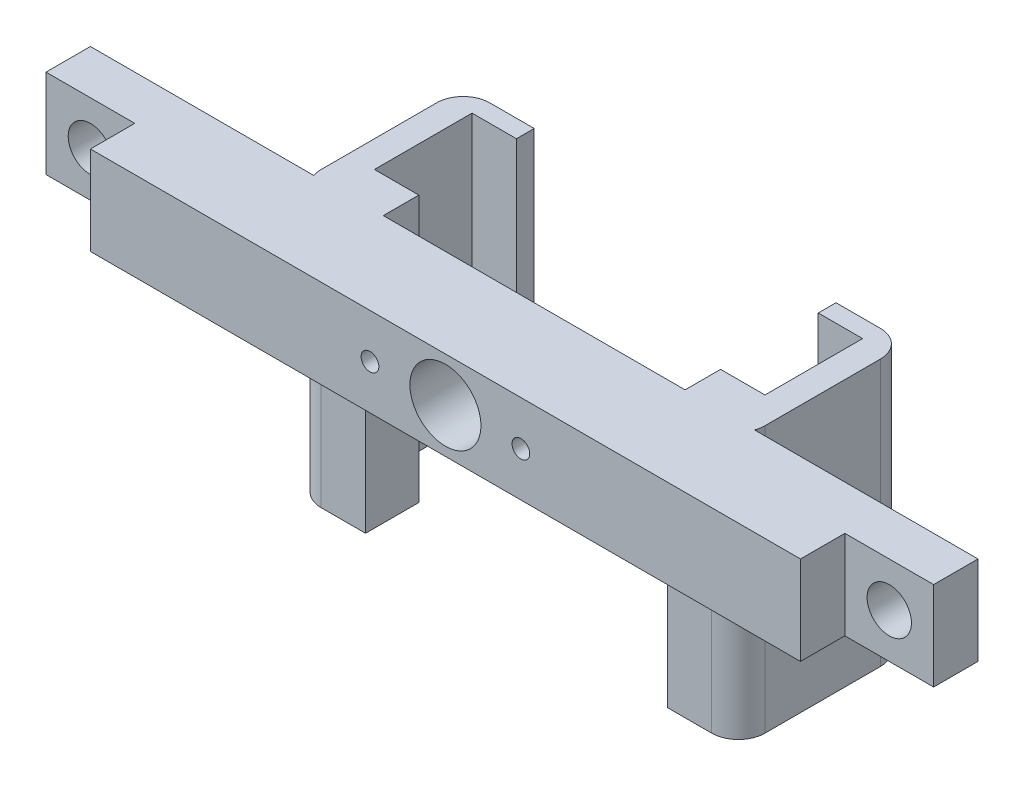
from build123d import *

# Parameters (mm, degrees)
SKETCH1_W           = 100
SKETCH1_H           = 10
BOSS_EXTRUDE1_DEPTH = 10
SKETCH6_W           = 3
SKETCH6_H           = 10
BOSS_EXTRUDE2_DEPTH = 17
SKETCH8_W           = 2
SKETCH8_H           = 10
BOSS_EXTRUDE3_DEPTH = 5
BOSS_EXTRUDE4_DEPTH = 20
SKETCH2_W           = 10
SKETCH2_H           = 5
CUT_EXTRUDE1_DEPTH  = 10
CUT_EXTRUDE2_REACH  = 62.075
SKETCH10_R          = 2.5
SKETCH13_R          = 4
SKETCH13_R_2        = 1
CUT_EXTRUDE3_DEPTH  = 59.429444632
FILLET1_R           = 3
FILLET2_R           = 3
SKETCH14_W          = 5
SKETCH14_H          = 30
BOSS_EXTRUDE5_DEPTH = 4


with BuildPart() as part:
    # Sketch1 → Boss-Extrude1 (new body)
    with BuildSketch(Plane.XY):
        Rectangle(SKETCH1_W, SKETCH1_H)
    extrude(amount=BOSS_EXTRUDE1_DEPTH)

    # Sketch6 → Boss-Extrude2 (add)
    with BuildSketch(Plane(origin=(0, 0, 0), x_dir=(-1, 0, 0), z_dir=(0, 0, -1))):
        with Locations((-23.5, 0)):
            Rectangle(SKETCH6_W, SKETCH6_H)
    boss_extrude2 = extrude(amount=BOSS_EXTRUDE2_DEPTH)

    # Sketch8 → Boss-Extrude3 (add)
    with BuildSketch(Plane.ZY.offset(-22)):
        with Locations((-16, 0)):
            Rectangle(SKETCH8_W, SKETCH8_H)
    boss_extrude3 = extrude(amount=BOSS_EXTRUDE3_DEPTH)

    # Sketch9 → Boss-Extrude4 (add)
    with BuildSketch(Plane.XZ.offset(5)):
        Polygon((17, 2), (17, 0), (22, 0), (22, -15), (17, -15), (17, -17), (25, -17), (25, 0), (25, 2), align=None)
    boss_extrude4 = extrude(amount=BOSS_EXTRUDE4_DEPTH)

    # Mirror3: Boss-Extrude2, Boss-Extrude3, Boss-Extrude4 across plane
    add(boss_extrude2.mirror(Plane(origin=(0, 0, 0), x_dir=(0, 0, 1), z_dir=(1, 0, 0))))
    add(boss_extrude3.mirror(Plane(origin=(0, 0, 0), x_dir=(0, 0, 1), z_dir=(1, 0, 0))))
    add(boss_extrude4.mirror(Plane(origin=(0, 0, 0), x_dir=(0, 0, 1), z_dir=(1, 0, 0))))

    # Sketch2 → Cut-Extrude1 (cut)
    with BuildSketch(Plane(origin=(0, 5, 0), x_dir=(1, 0, 0), z_dir=(0, 1, 0))):
        with Locations((-45, -7.5)):
            Rectangle(SKETCH2_W, SKETCH2_H)
    cut_extrude1 = extrude(amount=-CUT_EXTRUDE1_DEPTH, mode=Mode.SUBTRACT)

    # Mirror4: Cut-Extrude1 across plane
    add(cut_extrude1.mirror(Plane(origin=(0, 0, 0), x_dir=(0, 0, 1), z_dir=(1, 0, 0))), mode=Mode.SUBTRACT)

    # Sketch10 → Cut-Extrude2 (cut, up to next)
    with BuildSketch(Plane.XY.offset(5), mode=Mode.PRIVATE) as cut_extrude2_sk1:
        with Locations((45, 0)):
            Circle(SKETCH10_R)
    cut_extrude2_tool1 = extrude(cut_extrude2_sk1.sketch, amount=-CUT_EXTRUDE2_REACH, mode=Mode.PRIVATE) & part.part
    cut_extrude2 = cut_extrude2_tool1.solids().sort_by_distance((45, 0, 5))[0]
    add(cut_extrude2, mode=Mode.SUBTRACT)

    # Mirror5: Cut-Extrude2 across plane
    add(cut_extrude2.mirror(Plane(origin=(0, 0, 0), x_dir=(0, 0, 1), z_dir=(1, 0, 0))), mode=Mode.SUBTRACT)

    # Sketch13 → Cut-Extrude3 (cut, through all)
    with BuildSketch(Plane(origin=(0, 0, 0), x_dir=(-1, 0, 0), z_dir=(0, 0, -1))):
        Circle(SKETCH13_R)
        with Locations((-8.5, 0)):
            Circle(SKETCH13_R_2)
        with Locations((8.5, 0)):
            Circle(SKETCH13_R_2)
    extrude(amount=-CUT_EXTRUDE3_DEPTH, mode=Mode.SUBTRACT)

    # Fillet1
    fillet1_edges = [part.edges().sort_by_distance(p)[0] for p in [
        (25, -10, -17),
        (-25, -10, -17),
    ]]
    fillet(fillet1_edges, radius=FILLET1_R)

    # Fillet2
    fillet2_edges = [part.edges().sort_by_distance(p)[0] for p in [
        (-25, -15, 2),
        (25, -15, 2),
    ]]
    fillet(fillet2_edges, radius=FILLET2_R)

    # Sketch14 → Boss-Extrude5 (add)
    with BuildSketch(Plane(origin=(0, 0, 0), x_dir=(-1, 0, 0), z_dir=(0, 0, -1))):
        with Locations((19.5, -10)):
            Rectangle(SKETCH14_W, SKETCH14_H)
    boss_extrude5 = extrude(amount=BOSS_EXTRUDE5_DEPTH)

    # Mirror6: Boss-Extrude5 across plane
    add(boss_extrude5.mirror(Plane(origin=(0, 0, 0), x_dir=(0, 0, 1), z_dir=(1, 0, 0))))


solid = part.part
